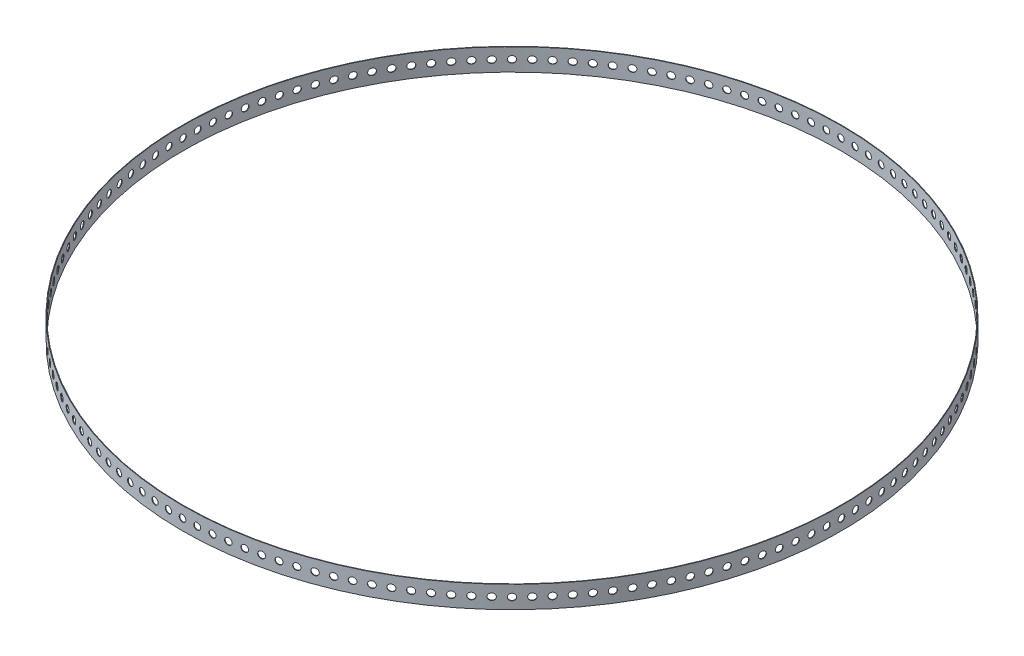
from build123d import *

# Parameters (mm, degrees)
SKETCH1_R           = 299.5
SKETCH1_R_2         = 299
BOSS_EXTRUDE1_DEPTH = 10
SKETCH2_R           = 3
CUT_EXTRUDE1_DEPTH  = 424.674993362
CIRPATTERN1_COUNT   = 144


with BuildPart() as part:
    # Sketch1 → Boss-Extrude1 (new, symmetric)
    with BuildSketch(Plane(origin=(0, 0, 0), x_dir=(1, 0, 0), z_dir=(0, 1, 0))):
        with Locations(Location((0, 0, 0), (0, 0, 270))):
            Circle(SKETCH1_R)
        with Locations(Location((0, 0, 0), (0, 0, 270))):
            Circle(SKETCH1_R_2, mode=Mode.SUBTRACT)
    extrude(amount=BOSS_EXTRUDE1_DEPTH, both=True)

    # Sketch2 → Cut-Extrude1 (cut, through all)
    with BuildSketch(Plane.XY):
        with Locations(Location((0, 0, 0), (0, 0, 90))):
            Circle(SKETCH2_R)
    cut_extrude1 = extrude(amount=-CUT_EXTRUDE1_DEPTH, mode=Mode.SUBTRACT)

    # CirPattern1: Cut-Extrude1 ×144 about axis
    cirpattern1_axis = Axis((0, 10, 0), (0, -1, 0))
    for i in range(1, CIRPATTERN1_COUNT):
        add(cut_extrude1.rotate(cirpattern1_axis, i * 360 / CIRPATTERN1_COUNT), mode=Mode.SUBTRACT)


solid = part.part
